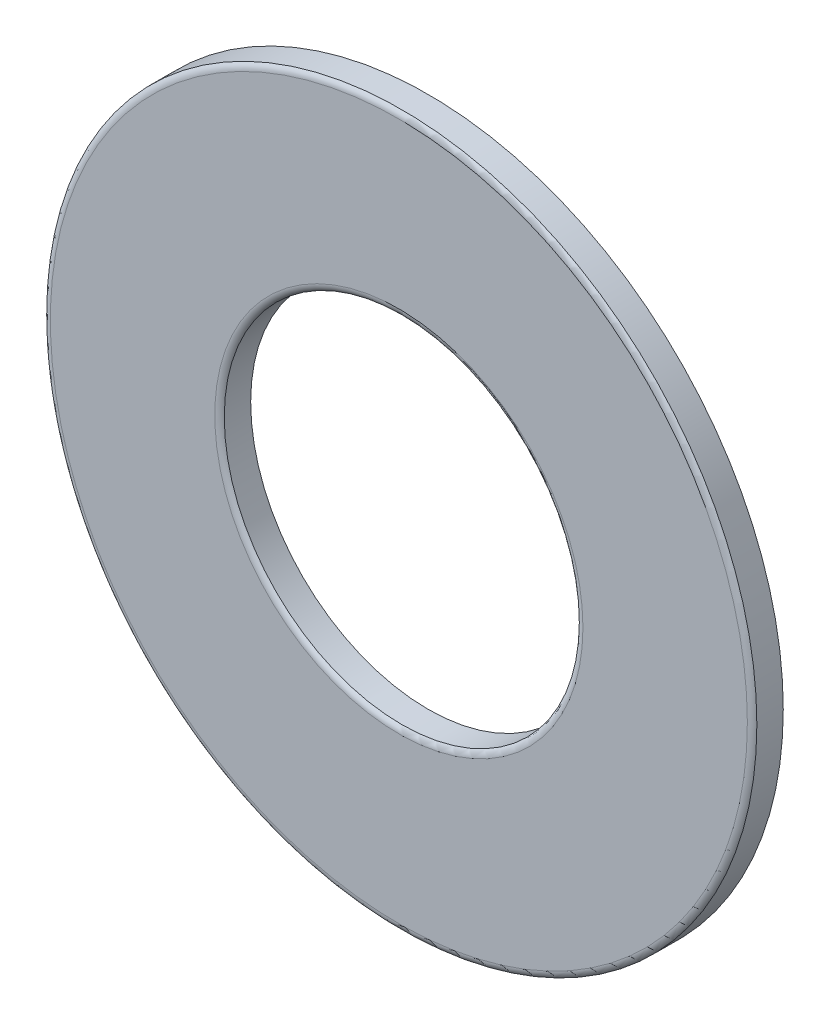
from build123d import *
from OCP.BRepFilletAPI import BRepFilletAPI_MakeChamfer

# Parameters (mm, degrees)
BOSS_EXTRUDE1_START = -0.7874
SKETCH3_R           = 19.05
SKETCH3_R_2         = 9.525
BOSS_EXTRUDE1_DEPTH = 1.5748
CHAMFER1_SIZE       = 0.15748
CHAMFER1_SIZE2      = 0.09092112
FILLET1_R           = 0.47244


with BuildPart() as part:
    # Sketch3 → Boss-Extrude1 (new body)
    with BuildSketch(Plane.XY.offset(BOSS_EXTRUDE1_START)):
        Circle(SKETCH3_R)
        Circle(SKETCH3_R_2, mode=Mode.SUBTRACT)
    extrude(amount=BOSS_EXTRUDE1_DEPTH)

    # Chamfer1: one chamfer whose edges measure the first distance from different faces: ONE call of the kernel's chamfer builder (chamfer() names one face for all edges)
    chamfer1_edges_1 = [part.edges().sort_by_distance(p)[0] for p in [
        (-19.05, 0, 0.7874),
    ]]
    chamfer1_side_1 = [part.faces().sort_by_distance(p)[0] for p in [
        (-19.05, 0, 0),
    ]]
    chamfer1_edges_2 = [part.edges().sort_by_distance(p)[0] for p in [
        (-9.525, 0, 0.7874),
    ]]
    chamfer1_side_2 = [part.faces().sort_by_distance(p)[0] for p in [
        (-9.525, 0, 0),
    ]]
    chamfer1 = BRepFilletAPI_MakeChamfer(part.part.solid().wrapped)
    for e in chamfer1_edges_1:
        chamfer1.Add(CHAMFER1_SIZE, CHAMFER1_SIZE2, e.wrapped, chamfer1_side_1[0].wrapped)  # the first distance lies on this face
    for e in chamfer1_edges_2:
        chamfer1.Add(CHAMFER1_SIZE, CHAMFER1_SIZE2, e.wrapped, chamfer1_side_2[0].wrapped)  # the first distance lies on this face
    add(Compound.cast(chamfer1.Shape()), mode=Mode.REPLACE)

    # Fillet1
    # the kernel refuses this fillet: 0.47244 mm, written as the material it takes off along each edge
    with BuildSketch(Plane(origin=(0, 0, 0.7874), x_dir=(1, 0, 0), z_dir=(0, -1, 0))) as fillet1_piece_1:
        with BuildLine():
            CenterArc((18.697864015, -0.47244), FILLET1_R, 41.810314896, 48.189685104)
            Line((18.697864015, 0), (18.697864015, 0.0094488))
            Line((18.697864015, 0.0094488), (18.95907888, 0.0094488))
            Line((18.95907888, 0.0094488), (18.96726178, 0.0047244))
            ThreePointArc((18.96726178, 0.0047244), (19.012722341, -0.0740156), (19.05704272, -0.1511808))
            Line((19.05704272, -0.1511808), (19.05, -0.15748))
        make_face()
    revolve(axis=Axis((0, 0, 0.7874), (0, 0, 1)), mode=Mode.SUBTRACT)
    with BuildSketch(Plane(origin=(0, 0, 0.7874), x_dir=(1, 0, 0), z_dir=(0, -1, 0))) as fillet1_piece_2:
        with BuildLine():
            CenterArc((9.877135985, -0.47244), FILLET1_R, 90, 48.189685104)
            Line((9.525, -0.15748), (9.51795728, -0.1511808))
            ThreePointArc((9.51795728, -0.1511808), (9.562277659, -0.0740156), (9.60773822, 0.0047244))
            Line((9.60773822, 0.0047244), (9.61592112, 0.0094488))
            Line((9.61592112, 0.0094488), (9.877135985, 0.0094488))
            Line((9.877135985, 0.0094488), (9.877135985, 0))
        make_face()
    revolve(axis=Axis((0, 0, 0.7874), (0, 0, 1)), mode=Mode.SUBTRACT)


solid = part.part
